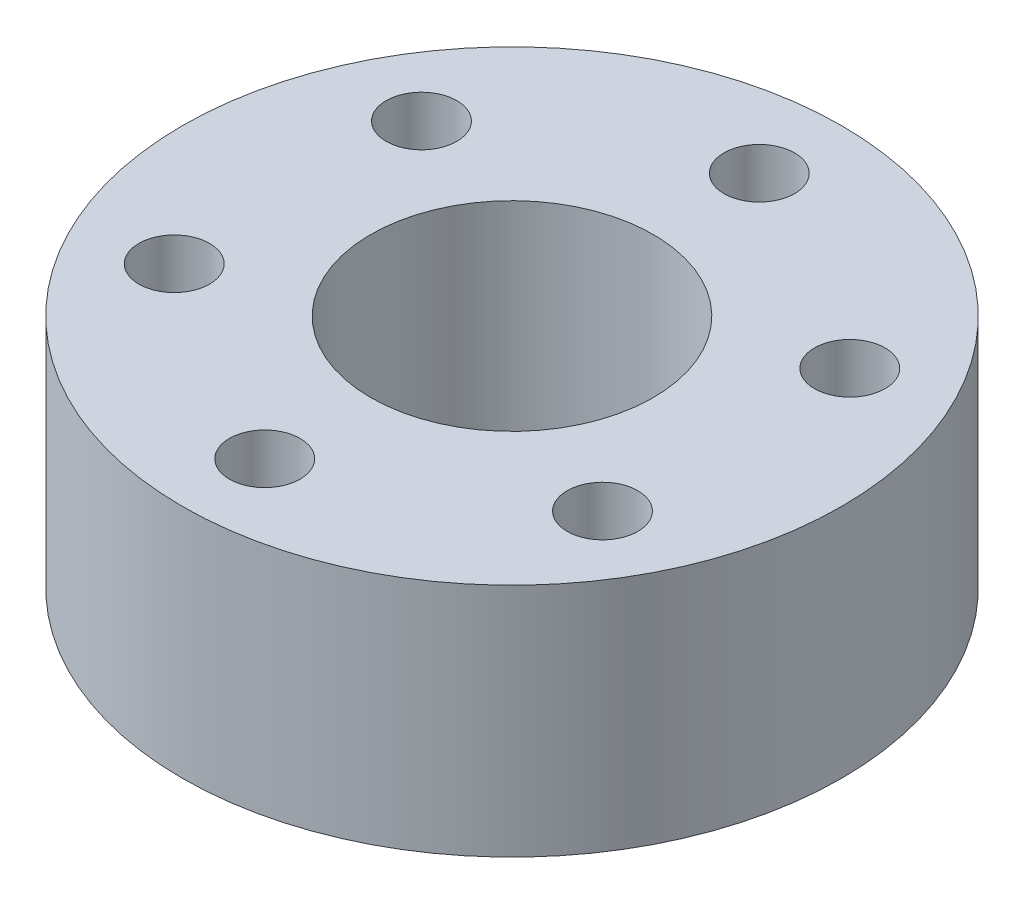
from build123d import *

# Parameters (mm, degrees)
SKETCH1_R           = 14
BOSS_EXTRUDE1_DEPTH = 10
SKETCH2_R           = 1.5
SKETCH2_R_2         = 6
CUT_EXTRUDE1_DEPTH  = 23.181073013


with BuildPart() as part:
    # Sketch1 → Boss-Extrude1 (new body)
    with BuildSketch(Plane(origin=(0, 0, 0), x_dir=(1, 0, 0), z_dir=(0, 1, 0))):
        Circle(SKETCH1_R)
    extrude(amount=BOSS_EXTRUDE1_DEPTH)

    # Sketch2 → Cut-Extrude1 (cut, through all)
    with BuildSketch(Plane(origin=(0, 10, 0), x_dir=(1, 0, 0), z_dir=(0, 1, 0))):
        with Locations((0, 10.5)):
            Circle(SKETCH2_R)
        Circle(SKETCH2_R_2)
        with Locations((9.09326674, 5.25)):
            Circle(SKETCH2_R)
        with Locations((9.09326674, -5.25)):
            Circle(SKETCH2_R)
        with Locations((0, -10.5)):
            Circle(SKETCH2_R)
        with Locations((-9.09326674, -5.25)):
            Circle(SKETCH2_R)
        with Locations((-9.09326674, 5.25)):
            Circle(SKETCH2_R)
    extrude(amount=-CUT_EXTRUDE1_DEPTH, mode=Mode.SUBTRACT)


solid = part.part
